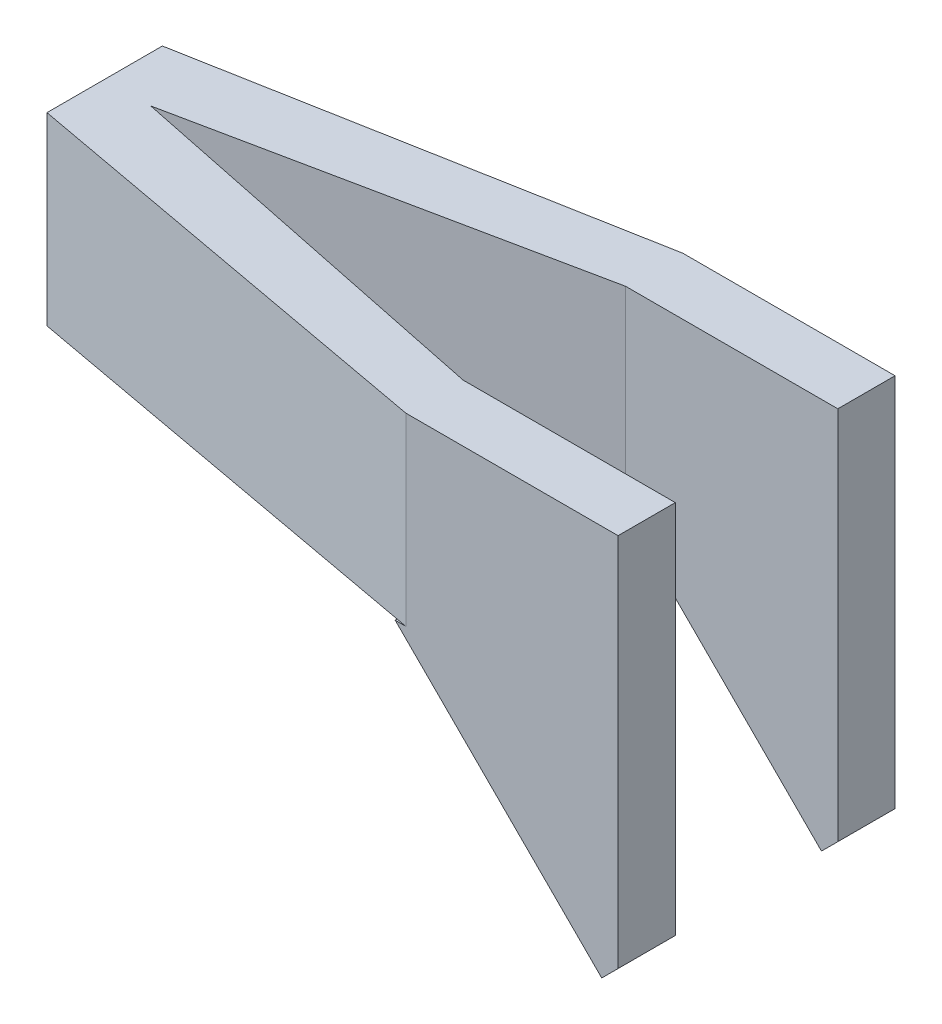
from build123d import *

# Parameters (mm, degrees)
BOSS_EXTRUDE2_START   = -76.2
SKETCH3_W             = 15.875
SKETCH3_H             = 25.4
BOSS_EXTRUDE2_DEPTH   = 6.35
SKETCH4_W             = 38.1
SKETCH4_H             = 7.874
SKETCH4_R             = 1.016
BOSS_EXTRUDE3_DEPTH   = 3.175
BOSS_EXTRUDE3_2_DEPTH = 3.175
BOSS_EXTRUDE4_REACH   = 85.527
BOSS_EXTRUDE5_DEPTH   = 25.4
BOSS_EXTRUDE7_DEPTH   = 25.4
BOSS_EXTRUDE8_START   = -19.05
BOSS_EXTRUDE8_DEPTH   = 7.874
BOSS_EXTRUDE8_START_2 = 11.176
BOSS_EXTRUDE8_2_DEPTH = 7.874
SKETCH9_R             = 1.89865
CUT_EXTRUDE2_DEPTH    = 3.81
SKETCH10_R            = 3.175
CUT_EXTRUDE3_DEPTH    = 96.846325291


with BuildPart() as part:
    # Sketch3 → Boss-Extrude2 (new body)
    with BuildSketch(Plane(origin=(0, 0, 0), x_dir=(0, 0, -1), z_dir=(1, 0, 0)).offset(BOSS_EXTRUDE2_START)):
        with Locations((0, 25.4)):
            Rectangle(SKETCH3_W, SKETCH3_H)
    extrude(amount=BOSS_EXTRUDE2_DEPTH)



with BuildPart() as body_2:
    # Sketch4 → Boss-Extrude3 (new body)
    with BuildSketch(Plane(origin=(0, 0, 0), x_dir=(-0.7071067811865477, 0.7071067811865475, 0), z_dir=(-0.7071067811865475, -0.7071067811865477, 0))):
        with Locations((0, -15.113)):
            Rectangle(SKETCH4_W, SKETCH4_H)
        with Locations((13.97, -13.97)):
            Circle(SKETCH4_R, mode=Mode.SUBTRACT)
        with Locations((-13.97, -13.97)):
            Circle(SKETCH4_R, mode=Mode.SUBTRACT)
    extrude(amount=BOSS_EXTRUDE3_DEPTH)

    # Boss-Extrude4: up to this face of the body (flat: up to its plane)
    boss_extrude4_end = Plane(body_2.part.faces().sort_by_distance((0, 0, 15.13825721))[0])
    # Sketch6 → Boss-Extrude4 (add, up to the picked face)
    with BuildSketch(Plane.XZ.offset(-12.7), mode=Mode.PRIVATE) as boss_extrude4_sk1:
        Polygon((-13.470384182, -19.05), (-15.715448212, -19.05), (-15.715448212, -11.176), (-13.470384182, -11.176), (13.470384182, -11.176), (13.470384182, -19.05), align=None)
    boss_extrude4_tool1 = split(extrude(boss_extrude4_sk1.sketch, amount=BOSS_EXTRUDE4_REACH, mode=Mode.PRIVATE), bisect_by=boss_extrude4_end, keep=Keep.BOTH, mode=Mode.PRIVATE)
    # Sketch6 → Boss-Extrude4 (add, up to the picked face)
    with BuildSketch(Plane.XZ.offset(-12.7), mode=Mode.PRIVATE) as boss_extrude4_sk2:
        Polygon((-13.470384182, 11.176), (-15.715448212, 11.176), (-15.715448212, 19.05), (-13.470384182, 19.05), (13.470384182, 19.05), (13.470384182, 11.176), align=None)
    boss_extrude4_tool2 = split(extrude(boss_extrude4_sk2.sketch, amount=BOSS_EXTRUDE4_REACH, mode=Mode.PRIVATE), bisect_by=boss_extrude4_end, keep=Keep.BOTH, mode=Mode.PRIVATE)


with BuildPart() as body_3:
    # Sketch4 → Boss-Extrude3 2 (new body)
    with BuildSketch(Plane(origin=(0, 0, 0), x_dir=(-0.7071067811865477, 0.7071067811865475, 0), z_dir=(-0.7071067811865475, -0.7071067811865477, 0))):
        with Locations((0, 15.113)):
            Rectangle(SKETCH4_W, SKETCH4_H)
        with Locations((13.97, 13.97)):
            Circle(SKETCH4_R, mode=Mode.SUBTRACT)
        with Locations((-13.97, 13.97)):
            Circle(SKETCH4_R, mode=Mode.SUBTRACT)
    extrude(amount=BOSS_EXTRUDE3_2_DEPTH)


with BuildPart() as body_2_1:
    add(body_2.part)

    add(body_3.part)  # Boss-Extrude4 merges body 3
    add(boss_extrude4_tool1.solids().sort_by(Axis((-1.122532, 12.7, -15.113), (0, -1, 0)))[0])
    add(boss_extrude4_tool2.solids().sort_by(Axis((-1.122532, 12.7, 15.113), (0, -1, 0)))[0])

    # Sketch6<2> → Boss-Extrude5 (add)
    with BuildSketch(Plane.XZ.offset(-12.7)):
        Polygon((-13.470384182, -19.05), (-15.715448212, -19.05), (-15.715448212, -11.176), (-13.470384182, -11.176), (13.470384182, -11.176), (13.470384182, -19.05), align=None)
        Polygon((-13.470384182, 11.176), (-15.715448212, 11.176), (-15.715448212, 19.05), (-13.470384182, 19.05), (13.470384182, 19.05), (13.470384182, 11.176), align=None)
    extrude(amount=-BOSS_EXTRUDE5_DEPTH)


with BuildPart() as part_1:
    add(part.part)

    add(body_2_1.part)  # Boss-Extrude7 merges body 2
    # Sketch7 → Boss-Extrude7 (add)
    with BuildSketch(Plane(origin=(0, 38.1, 0), x_dir=(1, 0, 0), z_dir=(0, 1, 0))):
        Polygon((-15.715448212, 19.05), (-76.2, 7.9375), (-76.2, -7.9375), (-15.715448212, -19.05), (-15.715448212, -11.176), (-69.85, 0), (-15.715448212, 11.176), align=None)
    extrude(amount=-BOSS_EXTRUDE7_DEPTH)

    # Boss-Extrude8: read off the stored shape, not the designer's step
    # Boss-Extrude8 outline → Boss-Extrude8 (add)
    with BuildSketch(Plane.XY.offset(BOSS_EXTRUDE8_START)):
        Polygon((-14.240768363, 12.7), (-17.190128061, 12.7), (-15.715448212, 11.225320151), align=None)
    extrude(amount=BOSS_EXTRUDE8_DEPTH)

    # Boss-Extrude8 2 outline → Boss-Extrude8 2 (add)
    with BuildSketch(Plane.XY.offset(BOSS_EXTRUDE8_START_2)):
        Polygon((-14.240768363, 12.7), (-17.190128061, 12.7), (-15.715448212, 11.225320151), align=None)
    extrude(amount=BOSS_EXTRUDE8_2_DEPTH)

    # Sketch9 → Cut-Extrude2 (cut)
    with BuildSketch(Plane.ZY.offset(76.2)):
        with Locations((0, 25.4)):
            Circle(SKETCH9_R)
    extrude(amount=-CUT_EXTRUDE2_DEPTH, mode=Mode.SUBTRACT)

    # Sketch10 → Cut-Extrude3 (cut, through all)
    with BuildSketch(Plane.ZY.offset(72.39)):
        with Locations((0, 25.4)):
            Circle(SKETCH10_R)
    extrude(amount=-CUT_EXTRUDE3_DEPTH, mode=Mode.SUBTRACT)


solid = part_1.part
